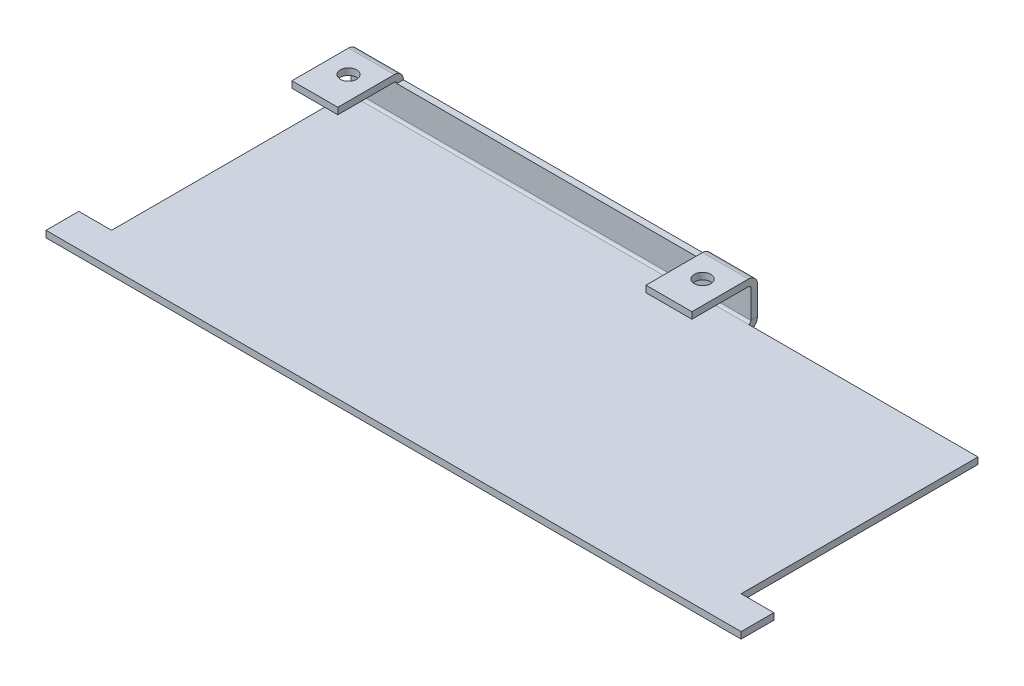
from build123d import *

# Parameters (mm, degrees)
SKETCH1_W                    = 212
SKETCH1_H                    = 85
BASE_FLANGE1_DEPTH           = 2
CUT_EXTRUDE1_REACH           = 230.414
SKETCH6_W                    = 10
SKETCH6_H                    = 75
EDGE_FLANGE1_STRIP_W         = 9.4732
EDGE_FLANGE1_STRIP_H         = 2
EDGE_FLANGE1_STRIP_CUT_DEPTH = 192
EDGE_FLANGE1_DEPTH           = 192
EDGE_FLANGE2_STRIP_W         = 9.4732
EDGE_FLANGE2_STRIP_H         = 2
EDGE_FLANGE2_STRIP_CUT_DEPTH = 192
EDGE_FLANGE2_DEPTH           = 192
CUT_EXTRUDE2_START           = -2.7366
SKETCH13_R                   = 2.5
SKETCH13_W                   = 70
SKETCH13_H                   = 20
SKETCH13_W_2                 = 94
CUT_EXTRUDE2_DEPTH           = 2.7366
CUT_EXTRUDE3_START           = -2.7366
SKETCH14_W                   = 70
SKETCH14_H                   = 11.2634
CUT_EXTRUDE3_DEPTH           = 2.7366


# Sheet-metal steps are written as plain solids
with BuildPart() as part:
    # Sketch1 → Base-Flange1 (new body)
    with BuildSketch(Plane(origin=(0, 0, 0), x_dir=(1, 0, 0), z_dir=(0, 1, 0))):
        with Locations((106, 42.5)):
            Rectangle(SKETCH1_W, SKETCH1_H)
    extrude(amount=-BASE_FLANGE1_DEPTH)

    # Sketch6 → Cut-Extrude1 (cut, up to next)
    with BuildSketch(Plane(origin=(0, 0, 0), x_dir=(1, 0, 0), z_dir=(0, 1, 0)), mode=Mode.PRIVATE) as cut_extrude1_sk1:
        with Locations((5, 47.5)):
            Rectangle(SKETCH6_W, SKETCH6_H)
    cut_extrude1_tool1 = extrude(cut_extrude1_sk1.sketch, amount=-CUT_EXTRUDE1_REACH, mode=Mode.PRIVATE) & part.part
    # Sketch6 → Cut-Extrude1 (cut, up to next)
    with BuildSketch(Plane(origin=(0, 0, 0), x_dir=(1, 0, 0), z_dir=(0, 1, 0)), mode=Mode.PRIVATE) as cut_extrude1_sk2:
        with Locations((207, 47.5)):
            Rectangle(SKETCH6_W, SKETCH6_H)
    cut_extrude1_tool2 = extrude(cut_extrude1_sk2.sketch, amount=-CUT_EXTRUDE1_REACH, mode=Mode.PRIVATE) & part.part
    add(cut_extrude1_tool1.solids().sort_by_distance((5, 0, -47.5))[0], mode=Mode.SUBTRACT)
    add(cut_extrude1_tool2.solids().sort_by_distance((207, 0, -47.5))[0], mode=Mode.SUBTRACT)

    # Edge-Flange1 strip (across the edge) → Edge-Flange1 strip cut (cut)
    with BuildSketch(Plane(origin=(202, 0, -85), x_dir=(0, 0, 1), z_dir=(-1, 0, 0))):
        with Locations((-2, -1)):
            Rectangle(EDGE_FLANGE1_STRIP_W, EDGE_FLANGE1_STRIP_H)
    extrude(amount=EDGE_FLANGE1_STRIP_CUT_DEPTH, mode=Mode.SUBTRACT)

    # Edge-Flange1 section (across the edge) → Edge-Flange1 (add)
    with BuildSketch(Plane(origin=(202, 0, -85), x_dir=(0, 0, 1), z_dir=(-1, 0, 0))):
        with BuildLine():
            Line((0, 0.7366), (0, 10))
            Line((0, 10), (2, 10))
            Line((2, 10), (2, 0.7366))
            ThreePointArc((2, 0.7366), (2.215745145, 0.215745145), (2.7366, 0))
            Line((2.7366, 0), (2.7366, -2))
            ThreePointArc((2.7366, -2), (0.801531583, -1.198468417), (0, 0.7366))
        make_face()
    extrude(amount=EDGE_FLANGE1_DEPTH)

    # Edge-Flange2 strip (across the edge) → Edge-Flange2 strip cut (cut)
    with BuildSketch(Plane(origin=(202, 10, -83), x_dir=(0, -1, 0), z_dir=(-1, 0, 0))):
        with Locations((-4, -1)):
            Rectangle(EDGE_FLANGE2_STRIP_W, EDGE_FLANGE2_STRIP_H)
    extrude(amount=EDGE_FLANGE2_STRIP_CUT_DEPTH, mode=Mode.SUBTRACT)

    # Edge-Flange2 section (across the edge) → Edge-Flange2 (add)
    with BuildSketch(Plane(origin=(202, 10, -83), x_dir=(0, -1, 0), z_dir=(-1, 0, 0))):
        with BuildLine():
            Line((-2, 0.7366), (-2, 18))
            Line((-2, 18), (0, 18))
            Line((0, 18), (0, 0.7366))
            ThreePointArc((0, 0.7366), (0.215745145, 0.215745145), (0.7366, 0))
            Line((0.7366, 0), (0.7366, -2))
            ThreePointArc((0.7366, -2), (-1.198468417, -1.198468417), (-2, 0.7366))
        make_face()
    extrude(amount=EDGE_FLANGE2_DEPTH)

    # Sketch13 → Cut-Extrude2 (cut)
    with BuildSketch(Plane(origin=(0, 12, 0), x_dir=(1, 0, 0), z_dir=(0, 1, 0)).offset(CUT_EXTRUDE2_START)):
        with Locations(Location((125, 75.2634, 0), (0, 0, 270))):
            Circle(SKETCH13_R)
        with Locations(Location((17, 75.2634, 0), (0, 0, 270))):
            Circle(SKETCH13_R)
        with Locations((167, 75)):
            Rectangle(SKETCH13_W, SKETCH13_H)
        with Locations((71, 75)):
            Rectangle(SKETCH13_W_2, SKETCH13_H)
    extrude(amount=CUT_EXTRUDE2_DEPTH, mode=Mode.SUBTRACT)

    # Sketch14 → Cut-Extrude3 (cut)
    with BuildSketch(Plane(origin=(0, 0, -85), x_dir=(-1, 0, 0), z_dir=(0, 0, -1)).offset(CUT_EXTRUDE3_START)):
        with Locations((-167, 3.6317)):
            Rectangle(SKETCH14_W, SKETCH14_H)
    extrude(amount=CUT_EXTRUDE3_DEPTH, mode=Mode.SUBTRACT)


solid = part.part
